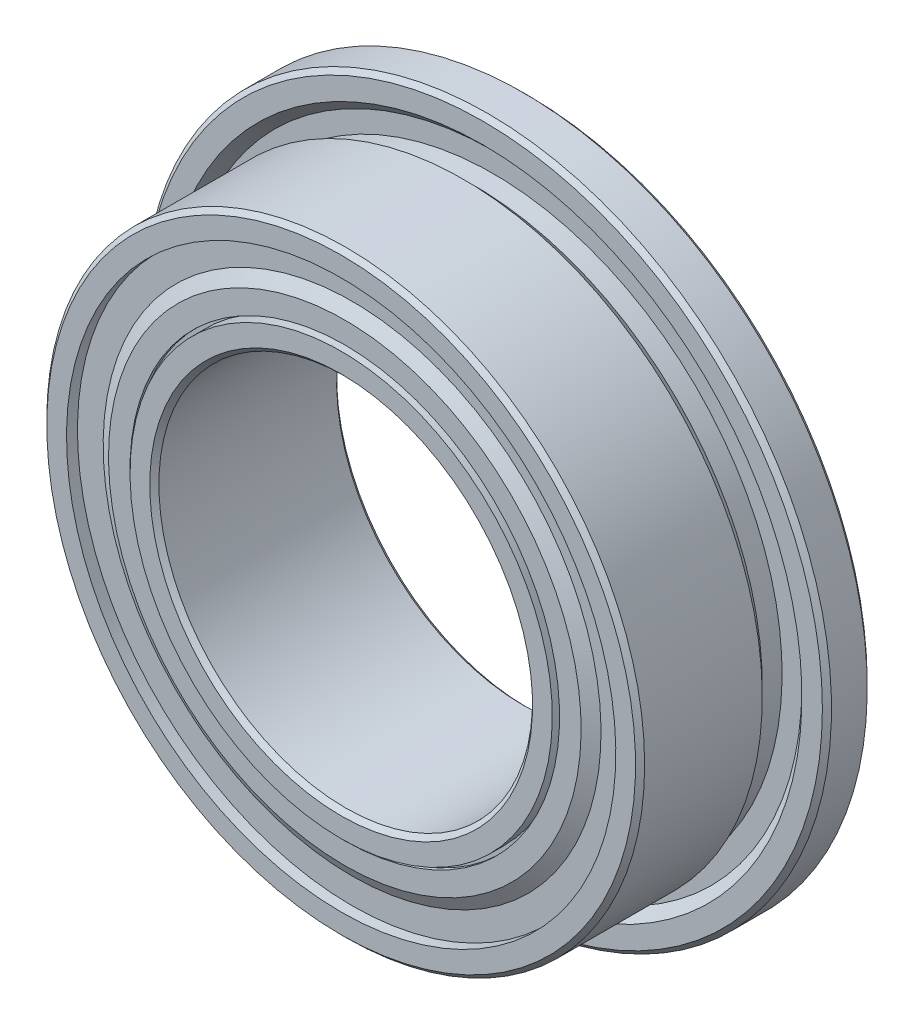
from build123d import *

# Parameters (mm, degrees)
FILLET1_SIZE      = 0.0609375
FILLET2_SIZE      = 0.0609375
CIRPATTERN3_COUNT = 21
SKETCH8_W         = 0.195
SKETCH8_H         = 0.1625


with BuildPart() as part:
    # Sketch2 → Revolve1 (revolve)
    with BuildSketch(Plane(origin=(0, 0, 0), x_dir=(0, 0, -1), z_dir=(1, 0, 0))):
        with BuildLine():
            Line((1.25, 4.6), (0.65, 4.6))
            Line((0.65, 4.6), (0.65, 4.265165043))
            Line((0.65, 4.265165043), (0.782582521, 4.132582521))
            Line((0.782582521, 4.132582521), (0.782582521, 3.867417479))
            Line((0.782582521, 3.867417479), (0.517417479, 3.867417479))
            Line((0.517417479, 3.867417479), (0.384834957, 4))
            Line((0.384834957, 4), (-1.25, 4))
            Line((-1.25, 4), (-1.25, 3.5125))
            Line((-1.25, 3.5125), (-0.301817412, 3.5125))
            ThreePointArc((-0.301817412, 3.5125), (0, 3.65), (0.301817412, 3.5125))
            Line((0.301817412, 3.5125), (1.25, 3.5125))
            Line((1.25, 3.5125), (1.25, 4.6))
        make_face()
        with BuildLine():
            Line((1.25, 2.5), (-1.25, 2.5))
            Line((-1.25, 2.5), (-1.25, 2.9875))
            Line((-1.25, 2.9875), (-0.301817412, 2.9875))
            ThreePointArc((-0.301817412, 2.9875), (0, 2.85), (0.301817412, 2.9875))
            Line((0.301817412, 2.9875), (1.25, 2.9875))
            Line((1.25, 2.9875), (1.25, 2.5))
        make_face()
    revolve(axis=Axis((0, 0, 0), (0, 0, -1)))

    # Fillet1
    fillet1_edges = [part.edges().sort_by_distance(p)[0] for p in [
        (0, -4.6, -1.25),
        (0, -4.6, -0.65),
        (0, -4, 1.25),
    ]]
    chamfer(fillet1_edges, length=FILLET1_SIZE)

    # Fillet2
    fillet2_edges = [part.edges().sort_by_distance(p)[0] for p in [
        (0, -2.5, -1.25),
        (0, -2.5, 1.25),
    ]]
    chamfer(fillet2_edges, length=FILLET2_SIZE)

    # Sketch8 → Cut-Revolve1 (revolve, cut)
    with BuildSketch(Plane(origin=(0, 0, 0), x_dir=(0, 0, -1), z_dir=(1, 0, 0))):
        with Locations((-1.1525, 3.59375)):
            Rectangle(SKETCH8_W, SKETCH8_H)
        with Locations((1.1525, 3.59375)):
            Rectangle(SKETCH8_W, SKETCH8_H)
        with Locations((1.1525, 2.90625)):
            Rectangle(SKETCH8_W, SKETCH8_H)
        with Locations((-1.1525, 2.90625)):
            Rectangle(SKETCH8_W, SKETCH8_H)
    revolve(axis=Axis((0, 0, 0), (0, 0, -1)), mode=Mode.SUBTRACT)


with BuildPart() as body_2:
    # Sketch7 → Revolve3 (revolve)
    with BuildSketch(Plane.XY):
        with BuildLine():
            Line((0, 3.65), (0, 2.85))
            ThreePointArc((0, 2.85), (-0.4, 3.25), (0, 3.65))
        make_face()
    revolve(axis=Axis((0, 3.65, 0), (0, -1, 0)))


with BuildPart() as cirpattern3_1:
    # CirPattern3: pattern copy
    add(body_2.part.rotate(Axis((0, 0, 0), (0, 0, -1)), 1 * 360 / CIRPATTERN3_COUNT))


with BuildPart() as cirpattern3_2:
    # CirPattern3: pattern copy
    add(body_2.part.rotate(Axis((0, 0, 0), (0, 0, -1)), 2 * 360 / CIRPATTERN3_COUNT))


with BuildPart() as cirpattern3_3:
    # CirPattern3: pattern copy
    add(body_2.part.rotate(Axis((0, 0, 0), (0, 0, -1)), 3 * 360 / CIRPATTERN3_COUNT))


with BuildPart() as cirpattern3_4:
    # CirPattern3: pattern copy
    add(body_2.part.rotate(Axis((0, 0, 0), (0, 0, -1)), 4 * 360 / CIRPATTERN3_COUNT))


with BuildPart() as cirpattern3_5:
    # CirPattern3: pattern copy
    add(body_2.part.rotate(Axis((0, 0, 0), (0, 0, -1)), 5 * 360 / CIRPATTERN3_COUNT))


with BuildPart() as cirpattern3_6:
    # CirPattern3: pattern copy
    add(body_2.part.rotate(Axis((0, 0, 0), (0, 0, -1)), 6 * 360 / CIRPATTERN3_COUNT))


with BuildPart() as cirpattern3_7:
    # CirPattern3: pattern copy
    add(body_2.part.rotate(Axis((0, 0, 0), (0, 0, -1)), 7 * 360 / CIRPATTERN3_COUNT))


with BuildPart() as cirpattern3_8:
    # CirPattern3: pattern copy
    add(body_2.part.rotate(Axis((0, 0, 0), (0, 0, -1)), 8 * 360 / CIRPATTERN3_COUNT))


with BuildPart() as cirpattern3_9:
    # CirPattern3: pattern copy
    add(body_2.part.rotate(Axis((0, 0, 0), (0, 0, -1)), 9 * 360 / CIRPATTERN3_COUNT))


with BuildPart() as cirpattern3_10:
    # CirPattern3: pattern copy
    add(body_2.part.rotate(Axis((0, 0, 0), (0, 0, -1)), 10 * 360 / CIRPATTERN3_COUNT))


with BuildPart() as cirpattern3_11:
    # CirPattern3: pattern copy
    add(body_2.part.rotate(Axis((0, 0, 0), (0, 0, -1)), 11 * 360 / CIRPATTERN3_COUNT))


with BuildPart() as cirpattern3_12:
    # CirPattern3: pattern copy
    add(body_2.part.rotate(Axis((0, 0, 0), (0, 0, -1)), 12 * 360 / CIRPATTERN3_COUNT))


with BuildPart() as cirpattern3_13:
    # CirPattern3: pattern copy
    add(body_2.part.rotate(Axis((0, 0, 0), (0, 0, -1)), 13 * 360 / CIRPATTERN3_COUNT))


with BuildPart() as cirpattern3_14:
    # CirPattern3: pattern copy
    add(body_2.part.rotate(Axis((0, 0, 0), (0, 0, -1)), 14 * 360 / CIRPATTERN3_COUNT))


with BuildPart() as cirpattern3_15:
    # CirPattern3: pattern copy
    add(body_2.part.rotate(Axis((0, 0, 0), (0, 0, -1)), 15 * 360 / CIRPATTERN3_COUNT))


with BuildPart() as cirpattern3_16:
    # CirPattern3: pattern copy
    add(body_2.part.rotate(Axis((0, 0, 0), (0, 0, -1)), 16 * 360 / CIRPATTERN3_COUNT))


with BuildPart() as cirpattern3_17:
    # CirPattern3: pattern copy
    add(body_2.part.rotate(Axis((0, 0, 0), (0, 0, -1)), 17 * 360 / CIRPATTERN3_COUNT))


with BuildPart() as cirpattern3_18:
    # CirPattern3: pattern copy
    add(body_2.part.rotate(Axis((0, 0, 0), (0, 0, -1)), 18 * 360 / CIRPATTERN3_COUNT))


with BuildPart() as cirpattern3_19:
    # CirPattern3: pattern copy
    add(body_2.part.rotate(Axis((0, 0, 0), (0, 0, -1)), 19 * 360 / CIRPATTERN3_COUNT))


with BuildPart() as cirpattern3_20:
    # CirPattern3: pattern copy
    add(body_2.part.rotate(Axis((0, 0, 0), (0, 0, -1)), 20 * 360 / CIRPATTERN3_COUNT))


with BuildPart() as body_23:
    # Sketch9 → Revolve4 (revolve)
    with BuildSketch(Plane(origin=(0, 0, 0), x_dir=(0, 0, -1), z_dir=(1, 0, 0))):
        Polygon((-1.055, 3.675), (-1.055, 3.317857143), (-1.1525, 3.148982189), (-1.1525, 2.87375), (-1.20125, 2.87375), (-1.20125, 3.162044712), (-1.10375, 3.330919666), (-1.10375, 3.675), align=None)
        Polygon((1.055, 3.675), (1.055, 3.317857143), (1.1525, 3.148982189), (1.1525, 2.87375), (1.20125, 2.87375), (1.20125, 3.162044712), (1.10375, 3.330919666), (1.10375, 3.675), align=None)
    revolve(axis=Axis((0, 0, 0), (0, 0, -1)))


solid = Compound([part.part, body_2.part, cirpattern3_1.part, cirpattern3_2.part, cirpattern3_3.part, cirpattern3_4.part, cirpattern3_5.part, cirpattern3_6.part, cirpattern3_7.part, cirpattern3_8.part, cirpattern3_9.part, cirpattern3_10.part, cirpattern3_11.part, cirpattern3_12.part, cirpattern3_13.part, cirpattern3_14.part, cirpattern3_15.part, cirpattern3_16.part, cirpattern3_17.part, cirpattern3_18.part, cirpattern3_19.part, cirpattern3_20.part, body_23.part])
